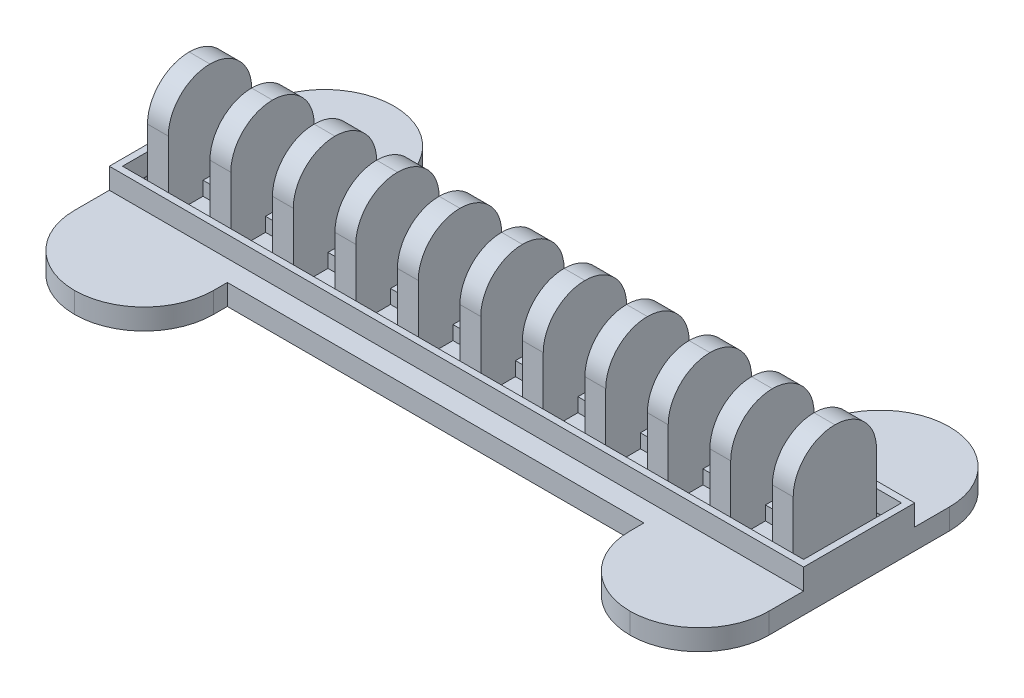
from build123d import *

# Parameters (mm, degrees)
SKETCH1_W            = 100
SKETCH1_H            = 16
BOSS_EXTRUDE1_DEPTH  = 3
SKETCH2_W            = 98
SKETCH2_H            = 14
CUT_EXTRUDE1_DEPTH   = 1
SKETCH5_W            = 20
SKETCH5_H            = 3
BOSS_EXTRUDE4_DEPTH  = 15
SKETCH6_W            = 20
SKETCH6_H            = 3
BOSS_EXTRUDE5_DEPTH  = 15
FILLET18_R           = 10
SKETCH7_W            = 3
SKETCH7_H            = 12
BOSS_EXTRUDE6_DEPTH  = 16
SKETCH8_W            = 6
SKETCH8_H            = 2
BOSS_EXTRUDE7_DEPTH  = 2
FILLET19_R           = 6
SKETCH10_W           = 60
SKETCH10_H           = 3
BOSS_EXTRUDE8_DEPTH  = 3
SKETCH11_W           = 60
SKETCH11_H           = 3
BOSS_EXTRUDE9_DEPTH  = 3
SKETCH12_W           = 0.95
SKETCH12_H           = 14
BOSS_EXTRUDE10_DEPTH = 3
SKETCH13_W           = 100
SKETCH13_H           = 0.95
BOSS_EXTRUDE11_DEPTH = 3
SKETCH14_W           = 0.95
SKETCH14_H           = 0.052088128
BOSS_EXTRUDE12_DEPTH = 3
SKETCH15_W           = 0.95
SKETCH15_H           = 0.047911872
SKETCH15_W_2         = 0.949734752
SKETCH15_H_2         = 0.052088128
BOSS_EXTRUDE13_DEPTH = 3


with BuildPart() as part:
    # Sketch1 → Boss-Extrude1 (new body)
    with BuildSketch(Plane(origin=(0, 0, 0), x_dir=(1, 0, 0), z_dir=(0, 1, 0))):
        with Locations((50, 8)):
            Rectangle(SKETCH1_W, SKETCH1_H)
    extrude(amount=BOSS_EXTRUDE1_DEPTH)

    # Sketch2 → Cut-Extrude1 (cut)
    with BuildSketch(Plane(origin=(0, 3, 0), x_dir=(1, 0, 0), z_dir=(0, 1, 0))):
        with Locations((50, 8)):
            Rectangle(SKETCH2_W, SKETCH2_H)
    extrude(amount=-CUT_EXTRUDE1_DEPTH, mode=Mode.SUBTRACT)

    # Sketch5 → Boss-Extrude4 (add)
    with BuildSketch(Plane.XY):
        with Locations((10, 1.5)):
            Rectangle(SKETCH5_W, SKETCH5_H)
        with Locations((90, 1.5)):
            Rectangle(SKETCH5_W, SKETCH5_H)
    extrude(amount=BOSS_EXTRUDE4_DEPTH)

    # Sketch6 → Boss-Extrude5 (add)
    with BuildSketch(Plane(origin=(0, 0, -16), x_dir=(-1, 0, 0), z_dir=(0, 0, -1))):
        with Locations((-90, 1.5)):
            Rectangle(SKETCH6_W, SKETCH6_H)
        with Locations((-10, 1.5)):
            Rectangle(SKETCH6_W, SKETCH6_H)
    extrude(amount=BOSS_EXTRUDE5_DEPTH)

    # Fillet18
    fillet18_edges = [part.edges().sort_by_distance(p)[0] for p in [
        (20, 1.5, 15),
        (0, 1.5, 15),
        (80, 1.5, 15),
        (100, 1.5, 15),
        (0, 1.5, -31),
        (20, 1.5, -31),
        (80, 1.5, -31),
        (100, 1.5, -31),
    ]]
    fillet(fillet18_edges, radius=FILLET18_R - 0.0001)  # a hair under: the kernel refuses the full size

    # Sketch7 → Boss-Extrude6 (add)
    with BuildSketch(Plane(origin=(0, 2, 0), x_dir=(1, 0, 0), z_dir=(0, 1, 0))):
        with Locations((95, 8)):
            Rectangle(SKETCH7_W, SKETCH7_H)
        with Locations((86, 8)):
            Rectangle(SKETCH7_W, SKETCH7_H)
        with Locations((77, 8)):
            Rectangle(SKETCH7_W, SKETCH7_H)
        with Locations((68, 8)):
            Rectangle(SKETCH7_W, SKETCH7_H)
        with Locations((59, 8)):
            Rectangle(SKETCH7_W, SKETCH7_H)
        with Locations((50, 8)):
            Rectangle(SKETCH7_W, SKETCH7_H)
        with Locations((41, 8)):
            Rectangle(SKETCH7_W, SKETCH7_H)
        with Locations((32, 8)):
            Rectangle(SKETCH7_W, SKETCH7_H)
        with Locations((23, 8)):
            Rectangle(SKETCH7_W, SKETCH7_H)
        with Locations((14, 8)):
            Rectangle(SKETCH7_W, SKETCH7_H)
        with Locations((5, 8)):
            Rectangle(SKETCH7_W, SKETCH7_H)
    extrude(amount=BOSS_EXTRUDE6_DEPTH)

    # Sketch8 → Boss-Extrude7 (add)
    with BuildSketch(Plane(origin=(0, 2, 0), x_dir=(1, 0, 0), z_dir=(0, 1, 0))):
        with Locations((90.5, 8)):
            Rectangle(SKETCH8_W, SKETCH8_H)
        with Locations((81.5, 8)):
            Rectangle(SKETCH8_W, SKETCH8_H)
        with Locations((72.5, 8)):
            Rectangle(SKETCH8_W, SKETCH8_H)
        with Locations((63.5, 8)):
            Rectangle(SKETCH8_W, SKETCH8_H)
        with Locations((54.5, 8)):
            Rectangle(SKETCH8_W, SKETCH8_H)
        with Locations((45.5, 8)):
            Rectangle(SKETCH8_W, SKETCH8_H)
        with Locations((36.5, 8)):
            Rectangle(SKETCH8_W, SKETCH8_H)
        with Locations((27.5, 8)):
            Rectangle(SKETCH8_W, SKETCH8_H)
        with Locations((18.5, 8)):
            Rectangle(SKETCH8_W, SKETCH8_H)
        with Locations((9.5, 8)):
            Rectangle(SKETCH8_W, SKETCH8_H)
    extrude(amount=BOSS_EXTRUDE7_DEPTH)

    # Fillet19
    fillet19_edges = [part.edges().sort_by_distance(p)[0] for p in [
        (95, 18, -2),
        (95, 18, -14),
        (86, 18, -2),
        (86, 18, -14),
        (77, 18, -2),
        (77, 18, -14),
        (68, 18, -2),
        (68, 18, -14),
        (59, 18, -2),
        (59, 18, -14),
        (50, 18, -2),
        (50, 18, -14),
        (41, 18, -2),
        (41, 18, -14),
        (32, 18, -2),
        (32, 18, -14),
        (23, 18, -14),
        (23, 18, -2),
        (14, 18, -2),
        (14, 18, -14),
        (5, 18, -2),
        (5, 18, -14),
    ]]
    fillet(fillet19_edges, radius=FILLET19_R - 0.0001)  # a hair under: the kernel refuses the full size

    # Sketch10 → Boss-Extrude8 (add)
    with BuildSketch(Plane(origin=(0, 0, -16), x_dir=(-1, 0, 0), z_dir=(0, 0, -1))):
        with Locations((-50, 1.5)):
            Rectangle(SKETCH10_W, SKETCH10_H)
    extrude(amount=BOSS_EXTRUDE8_DEPTH)

    # Sketch11 → Boss-Extrude9 (add)
    with BuildSketch(Plane.XY):
        with Locations((50, 1.5)):
            Rectangle(SKETCH11_W, SKETCH11_H)
    extrude(amount=BOSS_EXTRUDE9_DEPTH)

    # Sketch12 → Boss-Extrude10 (add)
    with BuildSketch(Plane(origin=(0, 3, 0), x_dir=(1, 0, 0), z_dir=(0, 1, 0))):
        with Locations((99.525, 7.997911872)):
            Rectangle(SKETCH12_W, SKETCH12_H)
        with Locations((0.475, 7.997911872)):
            Rectangle(SKETCH12_W, SKETCH12_H)
    extrude(amount=BOSS_EXTRUDE10_DEPTH)

    # Sketch13 → Boss-Extrude11 (add)
    with BuildSketch(Plane(origin=(0, 3, 0), x_dir=(1, 0, 0), z_dir=(0, 1, 0))):
        with Locations((50, 15.525)):
            Rectangle(SKETCH13_W, SKETCH13_H)
        with Locations((50, 0.475)):
            Rectangle(SKETCH13_W, SKETCH13_H)
    extrude(amount=BOSS_EXTRUDE11_DEPTH)

    # Sketch14 → Boss-Extrude12 (add)
    with BuildSketch(Plane(origin=(0, 3, 0), x_dir=(1, 0, 0), z_dir=(0, 1, 0))):
        with Locations((0.475, 15.023955936)):
            Rectangle(SKETCH14_W, SKETCH14_H)
    extrude(amount=BOSS_EXTRUDE12_DEPTH)

    # Sketch15 → Boss-Extrude13 (add)
    with BuildSketch(Plane(origin=(0, 3, 0), x_dir=(1, 0, 0), z_dir=(0, 1, 0))):
        with Locations((0.475, 0.973955936)):
            Rectangle(SKETCH15_W, SKETCH15_H)
        with Locations((99.525132624, 0.973955936)):
            Rectangle(SKETCH15_W_2, SKETCH15_H)
        with Locations((99.525, 15.023955936)):
            Rectangle(SKETCH15_W, SKETCH15_H_2)
    extrude(amount=BOSS_EXTRUDE13_DEPTH)


solid = part.part
